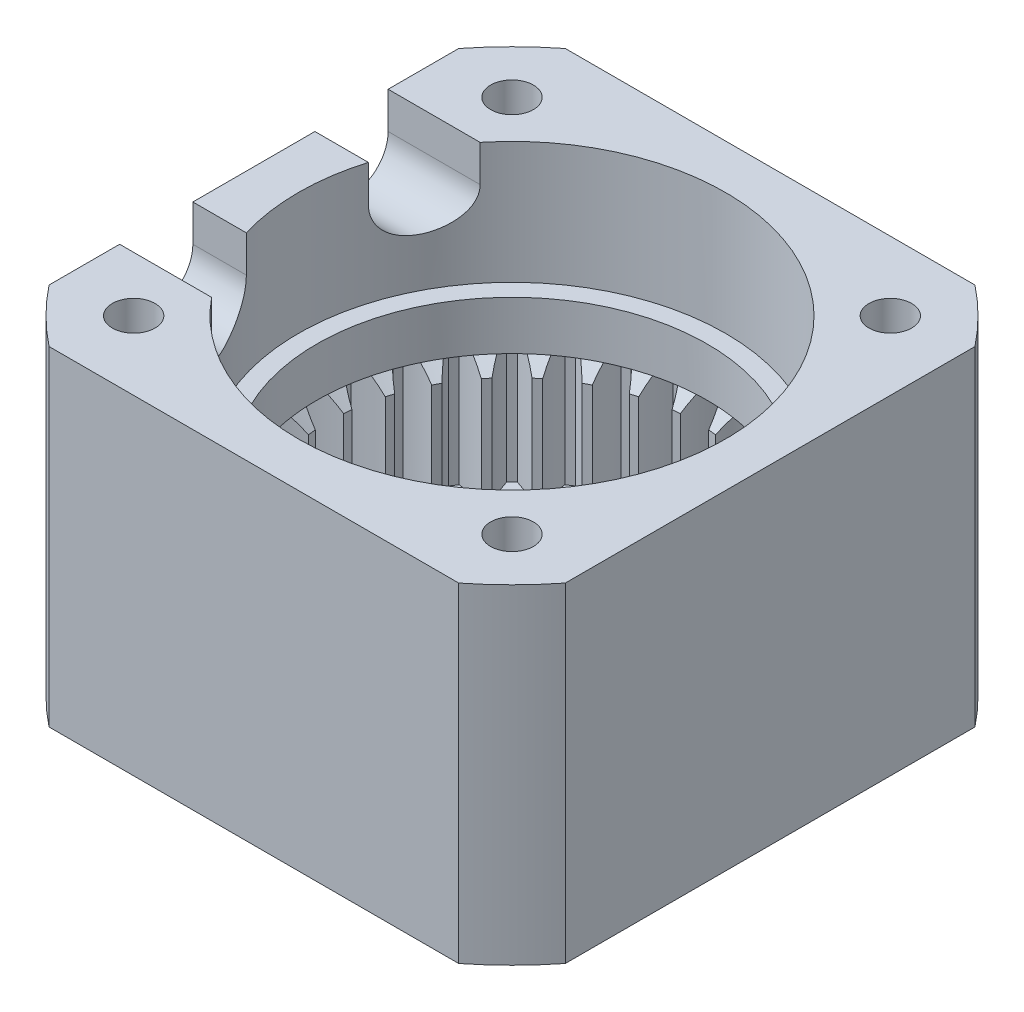
from build123d import *

# Parameters (mm, degrees)
SKETCH2_W           = 42.3
SKETCH2_H           = 42.3
BOSS_EXTRUDE1_DEPTH = 27
SKETCH3_R           = 11
CUT_EXTRUDE1_DEPTH  = 41.29447853
SKETCH4_R           = 1.75
CUT_EXTRUDE2_DEPTH  = 41.29447853
SKETCH5_R           = 29.910616844
SKETCH5_R_2         = 27
CUT_EXTRUDE4_DEPTH  = 41.29447853
SKETCH6_R           = 17.5
CUT_EXTRUDE5_DEPTH  = 24
BOSS_EXTRUDE2_START = 14
SKETCH7_R           = 17.5
SKETCH7_R_2         = 16
BOSS_EXTRUDE2_DEPTH = 14
SKETCH9_R           = 13
CUT_EXTRUDE6_DEPTH  = 39.348989556
INTERNAL_START      = 10
SKETCH12_R          = 16
SKETCH12_R_2        = 15
INTERNAL_GEAR_DEPTH = 10
CHAMFER4_SIZE       = 0.5
CAVITY2_START       = 3
CAVITY2_DEPTH       = 10
CUT_EXTRUDE7_DEPTH  = 10


# Read off the part's stored shape, not the designer's step: Cavity2
with BuildPart() as part:
    # Sketch2 → Boss-Extrude1 (new body)
    with BuildSketch(Plane(origin=(0, 0, 0), x_dir=(1, 0, 0), z_dir=(0, 1, 0))):
        Rectangle(SKETCH2_W, SKETCH2_H)
    extrude(amount=BOSS_EXTRUDE1_DEPTH)

    # Sketch3 → Cut-Extrude1 (cut, through all)
    with BuildSketch(Plane(origin=(0, 27, 0), x_dir=(1, 0, 0), z_dir=(0, 1, 0))):
        with Locations(Location((0, 0, 0), (0, 0, 270))):
            Circle(SKETCH3_R)
    extrude(amount=-CUT_EXTRUDE1_DEPTH, mode=Mode.SUBTRACT)

    # Sketch4 → Cut-Extrude2 (cut, through all)
    with BuildSketch(Plane(origin=(0, 27, 0), x_dir=(1, 0, 0), z_dir=(0, 1, 0))):
        with Locations(Location((-15.5, 15.5, 0), (0, 0, 270))):
            Circle(SKETCH4_R)
        with Locations(Location((15.5, 15.5, 0), (0, 0, 270))):
            Circle(SKETCH4_R)
        with Locations(Location((15.5, -15.5, 0), (0, 0, 270))):
            Circle(SKETCH4_R)
        with Locations(Location((-15.5, -15.5, 0), (0, 0, 270))):
            Circle(SKETCH4_R)
    extrude(amount=-CUT_EXTRUDE2_DEPTH, mode=Mode.SUBTRACT)

    # Sketch5 → Cut-Extrude4 (cut, through all)
    with BuildSketch(Plane(origin=(0, 27, 0), x_dir=(1, 0, 0), z_dir=(0, 1, 0))):
        Circle(SKETCH5_R)
        Circle(SKETCH5_R_2, mode=Mode.SUBTRACT)
    extrude(amount=-CUT_EXTRUDE4_DEPTH, mode=Mode.SUBTRACT)

    # Sketch6 → Cut-Extrude5 (cut)
    with BuildSketch(Plane(origin=(0, 27, 0), x_dir=(1, 0, 0), z_dir=(0, 1, 0))):
        with Locations(Location((0, 0, 0), (0, 0, 270))):
            Circle(SKETCH6_R)
    extrude(amount=-CUT_EXTRUDE5_DEPTH, mode=Mode.SUBTRACT)

    # Sketch7 → Boss-Extrude2 (add)
    with BuildSketch(Plane(origin=(0, 3, 0), x_dir=(1, 0, 0), z_dir=(0, 1, 0)).offset(BOSS_EXTRUDE2_START)):
        with Locations(Location((0, 0, 0), (0, 0, 270))):
            Circle(SKETCH7_R)
        with Locations(Location((0, 0, 0), (0, 0, 270))):
            Circle(SKETCH7_R_2, mode=Mode.SUBTRACT)
    extrude(amount=-BOSS_EXTRUDE2_DEPTH)

    # Sketch9 → Cut-Extrude6 (cut, through all)
    with BuildSketch(Plane(origin=(0, 3, 0), x_dir=(1, 0, 0), z_dir=(0, 1, 0))):
        with Locations(Location((0, 0, 0), (0, 0, 270))):
            Circle(SKETCH9_R)
    extrude(amount=-CUT_EXTRUDE6_DEPTH, mode=Mode.SUBTRACT)

    # Sketch12 → Internal gear (add)
    with BuildSketch(Plane(origin=(0, 3, 0), x_dir=(1, 0, 0), z_dir=(0, 1, 0)).offset(INTERNAL_START)):
        with Locations(Location((0, 0, 0), (0, 0, 270))):
            Circle(SKETCH12_R)
        with Locations(Location((0, 0, 0), (0, 0, 270))):
            Circle(SKETCH12_R_2, mode=Mode.SUBTRACT)
    extrude(amount=-INTERNAL_GEAR_DEPTH)

    # Chamfer4
    chamfer4_edges = [part.edges().sort_by_distance(p)[0] for p in [
        (-15.5, 0, 13.75),
        (15.5, 0, 13.75),
        (15.5, 0, -17.25),
        (-15.5, 0, -17.25),
    ]]
    chamfer(chamfer4_edges, length=CHAMFER4_SIZE)

    # Cavity2 outline → Cavity2 (cut)
    with BuildSketch(Plane(origin=(0, 0, 0), x_dir=(1, 0, 0), z_dir=(0, 1, 0)).offset(CAVITY2_START)):
        with BuildLine():
            ThreePointArc((-3.668509067, -16.856424361), (-3.365503145, -16.919526872), (-3.06141389, -16.977183099))
            ThreePointArc((-3.06141389, -16.977183099), (-2.340339096, -15.984916584), (-1.779431222, -14.894080184))
            ThreePointArc((-1.779431222, -14.894080184), (-2.92635483, -14.711779206), (-4.055737641, -14.441294685))
            ThreePointArc((-4.055737641, -14.441294685), (-3.954971354, -15.663746259), (-3.668509067, -16.856424361))
        make_face()
        with BuildLine():
            ThreePointArc((1.160450949, -14.95504442), (0, -15), (-1.160450949, -14.95504442))
            ThreePointArc((-1.160450949, -14.95504442), (-0.823132387, -16.134348402), (-0.309494437, -17.248223508))
            ThreePointArc((-0.309494437, -17.248223508), (0, -17.251), (0.309494437, -17.248223508))
            ThreePointArc((0.309494437, -17.248223508), (0.823132387, -16.134348402), (1.160450949, -14.95504442))
        make_face()
        with BuildLine():
            ThreePointArc((-6.314673798, -16.053719065), (-5.413872661, -15.221193386), (-4.650930849, -14.260744799))
            ThreePointArc((-4.650930849, -14.260744799), (-5.740251485, -13.858192988), (-6.79516461, -13.372574095))
            ThreePointArc((-6.79516461, -13.372574095), (-6.93482299, -14.591195132), (-6.88654495, -15.816842278))
            ThreePointArc((-6.88654495, -15.816842278), (-6.601671891, -15.937845815), (-6.314673798, -16.053719065))
        make_face()
        with BuildLine():
            ThreePointArc((4.055737641, -14.441294685), (2.92635483, -14.711779206), (1.779431222, -14.894080184))
            ThreePointArc((1.779431222, -14.894080184), (2.340339096, -15.984916584), (3.06141389, -16.977183099))
            ThreePointArc((3.06141389, -16.977183099), (3.365503145, -16.919526872), (3.668509067, -16.856424361))
            ThreePointArc((3.668509067, -16.856424361), (3.954971354, -15.663746259), (4.055737641, -14.441294685))
        make_face()
        with BuildLine():
            ThreePointArc((-9.325264334, -14.51331961), (-8.279354135, -13.872528263), (-7.343697812, -13.07937699))
            ThreePointArc((-7.343697812, -13.07937699), (-8.333553495, -12.472044185), (-9.273457214, -11.789952981))
            ThreePointArc((-9.273457214, -11.789952981), (-9.648173268, -12.957912559), (-9.839934773, -14.169427817))
            ThreePointArc((-9.839934773, -14.169427817), (-9.58414209, -14.343682282), (-9.325264334, -14.51331961))
        make_face()
        with BuildLine():
            ThreePointArc((6.79516461, -13.372574095), (5.740251485, -13.858192988), (4.650930849, -14.260744799))
            ThreePointArc((4.650930849, -14.260744799), (5.413872661, -15.221193386), (6.314673798, -16.053719065))
            ThreePointArc((6.314673798, -16.053719065), (6.601671891, -15.937845815), (6.88654495, -15.816842278))
            ThreePointArc((6.88654495, -15.816842278), (6.93482299, -14.591195132), (6.79516461, -13.372574095))
        make_face()
        with BuildLine():
            ThreePointArc((-11.977490191, -12.415181421), (-10.826664673, -11.990749658), (-9.754250587, -11.395376057))
            ThreePointArc((-9.754250587, -11.395376057), (-10.606601718, -10.606601718), (-11.395376057, -9.754250587))
            ThreePointArc((-11.395376057, -9.754250587), (-11.990749658, -10.826664673), (-12.415181421, -11.977490191))
            ThreePointArc((-12.415181421, -11.977490191), (-12.198299082, -12.198299082), (-11.977490191, -12.415181421))
        make_face()
        with BuildLine():
            ThreePointArc((9.273457214, -11.789952981), (8.333553495, -12.472044185), (7.343697812, -13.07937699))
            ThreePointArc((7.343697812, -13.07937699), (8.279354135, -13.872528263), (9.325264334, -14.51331961))
            ThreePointArc((9.325264334, -14.51331961), (9.58414209, -14.343682282), (9.839934773, -14.169427817))
            ThreePointArc((9.839934773, -14.169427817), (9.648173268, -12.957912559), (9.273457214, -11.789952981))
        make_face()
        with BuildLine():
            ThreePointArc((-14.169427817, -9.839934773), (-12.957912559, -9.648173268), (-11.789952981, -9.273457214))
            ThreePointArc((-11.789952981, -9.273457214), (-12.472044185, -8.333553495), (-13.07937699, -7.343697812))
            ThreePointArc((-13.07937699, -7.343697812), (-13.872528263, -8.279354135), (-14.51331961, -9.325264334))
            ThreePointArc((-14.51331961, -9.325264334), (-14.343682282, -9.58414209), (-14.169427817, -9.839934773))
        make_face()
        with BuildLine():
            ThreePointArc((11.395376057, -9.754250587), (10.606601718, -10.606601718), (9.754250587, -11.395376057))
            ThreePointArc((9.754250587, -11.395376057), (10.826664673, -11.990749658), (11.977490191, -12.415181421))
            ThreePointArc((11.977490191, -12.415181421), (12.198299082, -12.198299082), (12.415181421, -11.977490191))
            ThreePointArc((12.415181421, -11.977490191), (11.990749658, -10.826664673), (11.395376057, -9.754250587))
        make_face()
        with BuildLine():
            ThreePointArc((-15.816842278, -6.88654495), (-14.591195132, -6.93482299), (-13.372574095, -6.79516461))
            ThreePointArc((-13.372574095, -6.79516461), (-13.858192988, -5.740251485), (-14.260744799, -4.650930849))
            ThreePointArc((-14.260744799, -4.650930849), (-15.221193386, -5.413872661), (-16.053719065, -6.314673798))
            ThreePointArc((-16.053719065, -6.314673798), (-15.937845815, -6.601671891), (-15.816842278, -6.88654495))
        make_face()
        with BuildLine():
            ThreePointArc((13.07937699, -7.343697812), (12.472044185, -8.333553495), (11.789952981, -9.273457214))
            ThreePointArc((11.789952981, -9.273457214), (12.957912559, -9.648173268), (14.169427817, -9.839934773))
            ThreePointArc((14.169427817, -9.839934773), (14.343682282, -9.58414209), (14.51331961, -9.325264334))
            ThreePointArc((14.51331961, -9.325264334), (13.872528263, -8.279354135), (13.07937699, -7.343697812))
        make_face()
        with BuildLine():
            ThreePointArc((-16.856424361, -3.668509067), (-15.663746259, -3.954971354), (-14.441294685, -4.055737641))
            ThreePointArc((-14.441294685, -4.055737641), (-14.711779206, -2.92635483), (-14.894080184, -1.779431222))
            ThreePointArc((-14.894080184, -1.779431222), (-15.984916584, -2.340339096), (-16.977183099, -3.06141389))
            ThreePointArc((-16.977183099, -3.06141389), (-16.919526872, -3.365503145), (-16.856424361, -3.668509067))
        make_face()
        with BuildLine():
            ThreePointArc((14.260744799, -4.650930849), (13.858192988, -5.740251485), (13.372574095, -6.79516461))
            ThreePointArc((13.372574095, -6.79516461), (14.591195132, -6.93482299), (15.816842278, -6.88654495))
            ThreePointArc((15.816842278, -6.88654495), (15.937845815, -6.601671891), (16.053719065, -6.314673798))
            ThreePointArc((16.053719065, -6.314673798), (15.221193386, -5.413872661), (14.260744799, -4.650930849))
        make_face()
        with BuildLine():
            ThreePointArc((-17.248223508, -0.309494437), (-16.134348402, -0.823132387), (-14.95504442, -1.160450949))
            ThreePointArc((-14.95504442, -1.160450949), (-15, 0), (-14.95504442, 1.160450949))
            ThreePointArc((-14.95504442, 1.160450949), (-16.134348402, 0.823132387), (-17.248223508, 0.309494437))
            ThreePointArc((-17.248223508, 0.309494437), (-17.251, 0), (-17.248223508, -0.309494437))
        make_face()
        with BuildLine():
            ThreePointArc((14.894080184, -1.779431222), (14.711779206, -2.92635483), (14.441294685, -4.055737641))
            ThreePointArc((14.441294685, -4.055737641), (15.663746259, -3.954971354), (16.856424361, -3.668509067))
            ThreePointArc((16.856424361, -3.668509067), (16.919526872, -3.365503145), (16.977183099, -3.06141389))
            ThreePointArc((16.977183099, -3.06141389), (15.984916584, -2.340339096), (14.894080184, -1.779431222))
        make_face()
        with BuildLine():
            ThreePointArc((-16.977183099, 3.06141389), (-15.984916584, 2.340339096), (-14.894080184, 1.779431222))
            ThreePointArc((-14.894080184, 1.779431222), (-14.711779206, 2.92635483), (-14.441294685, 4.055737641))
            ThreePointArc((-14.441294685, 4.055737641), (-15.663746259, 3.954971354), (-16.856424361, 3.668509067))
            ThreePointArc((-16.856424361, 3.668509067), (-16.919526872, 3.365503145), (-16.977183099, 3.06141389))
        make_face()
        with BuildLine():
            ThreePointArc((14.95504442, 1.160450949), (15, 0), (14.95504442, -1.160450949))
            ThreePointArc((14.95504442, -1.160450949), (16.134348402, -0.823132387), (17.248223508, -0.309494437))
            ThreePointArc((17.248223508, -0.309494437), (17.251, 0), (17.248223508, 0.309494437))
            ThreePointArc((17.248223508, 0.309494437), (16.134348402, 0.823132387), (14.95504442, 1.160450949))
        make_face()
        with BuildLine():
            ThreePointArc((-16.053719065, 6.314673798), (-15.221193386, 5.413872661), (-14.260744799, 4.650930849))
            ThreePointArc((-14.260744799, 4.650930849), (-13.858192988, 5.740251485), (-13.372574095, 6.79516461))
            ThreePointArc((-13.372574095, 6.79516461), (-14.591195132, 6.93482299), (-15.816842278, 6.88654495))
            ThreePointArc((-15.816842278, 6.88654495), (-15.937845815, 6.601671891), (-16.053719065, 6.314673798))
        make_face()
        with BuildLine():
            ThreePointArc((-14.51331961, 9.325264334), (-13.872528263, 8.279354135), (-13.07937699, 7.343697812))
            ThreePointArc((-13.07937699, 7.343697812), (-12.472044185, 8.333553495), (-11.789952981, 9.273457214))
            ThreePointArc((-11.789952981, 9.273457214), (-12.957912559, 9.648173268), (-14.169427817, 9.839934773))
            ThreePointArc((-14.169427817, 9.839934773), (-14.343682282, 9.58414209), (-14.51331961, 9.325264334))
        make_face()
        with BuildLine():
            ThreePointArc((14.441294685, 4.055737641), (14.711779206, 2.92635483), (14.894080184, 1.779431222))
            ThreePointArc((14.894080184, 1.779431222), (15.984916584, 2.340339096), (16.977183099, 3.06141389))
            ThreePointArc((16.977183099, 3.06141389), (16.919526872, 3.365503145), (16.856424361, 3.668509067))
            ThreePointArc((16.856424361, 3.668509067), (15.663746259, 3.954971354), (14.441294685, 4.055737641))
        make_face()
        with BuildLine():
            ThreePointArc((-12.415181421, 11.977490191), (-11.990749658, 10.826664673), (-11.395376057, 9.754250587))
            ThreePointArc((-11.395376057, 9.754250587), (-10.606601718, 10.606601718), (-9.754250587, 11.395376057))
            ThreePointArc((-9.754250587, 11.395376057), (-10.826664673, 11.990749658), (-11.977490191, 12.415181421))
            ThreePointArc((-11.977490191, 12.415181421), (-12.198299082, 12.198299082), (-12.415181421, 11.977490191))
        make_face()
        with BuildLine():
            ThreePointArc((13.372574095, 6.79516461), (13.858192988, 5.740251485), (14.260744799, 4.650930849))
            ThreePointArc((14.260744799, 4.650930849), (15.221193386, 5.413872661), (16.053719065, 6.314673798))
            ThreePointArc((16.053719065, 6.314673798), (15.937845815, 6.601671891), (15.816842278, 6.88654495))
            ThreePointArc((15.816842278, 6.88654495), (14.591195132, 6.93482299), (13.372574095, 6.79516461))
        make_face()
        with BuildLine():
            ThreePointArc((-9.839934773, 14.169427817), (-9.648173268, 12.957912559), (-9.273457214, 11.789952981))
            ThreePointArc((-9.273457214, 11.789952981), (-8.333553495, 12.472044185), (-7.343697812, 13.07937699))
            ThreePointArc((-7.343697812, 13.07937699), (-8.279354135, 13.872528263), (-9.325264334, 14.51331961))
            ThreePointArc((-9.325264334, 14.51331961), (-9.58414209, 14.343682282), (-9.839934773, 14.169427817))
        make_face()
        with BuildLine():
            ThreePointArc((11.789952981, 9.273457214), (12.472044185, 8.333553495), (13.07937699, 7.343697812))
            ThreePointArc((13.07937699, 7.343697812), (13.872528263, 8.279354135), (14.51331961, 9.325264334))
            ThreePointArc((14.51331961, 9.325264334), (14.343682282, 9.58414209), (14.169427817, 9.839934773))
            ThreePointArc((14.169427817, 9.839934773), (12.957912559, 9.648173268), (11.789952981, 9.273457214))
        make_face()
        with BuildLine():
            ThreePointArc((-6.88654495, 15.816842278), (-6.93482299, 14.591195132), (-6.79516461, 13.372574095))
            ThreePointArc((-6.79516461, 13.372574095), (-5.740251485, 13.858192988), (-4.650930849, 14.260744799))
            ThreePointArc((-4.650930849, 14.260744799), (-5.413872661, 15.221193386), (-6.314673798, 16.053719065))
            ThreePointArc((-6.314673798, 16.053719065), (-6.601671891, 15.937845815), (-6.88654495, 15.816842278))
        make_face()
        with BuildLine():
            ThreePointArc((9.754250587, 11.395376057), (10.606601718, 10.606601718), (11.395376057, 9.754250587))
            ThreePointArc((11.395376057, 9.754250587), (11.990749658, 10.826664673), (12.415181421, 11.977490191))
            ThreePointArc((12.415181421, 11.977490191), (12.198299082, 12.198299082), (11.977490191, 12.415181421))
            ThreePointArc((11.977490191, 12.415181421), (10.826664673, 11.990749658), (9.754250587, 11.395376057))
        make_face()
        with BuildLine():
            ThreePointArc((-3.668509067, 16.856424361), (-3.954971354, 15.663746259), (-4.055737641, 14.441294685))
            ThreePointArc((-4.055737641, 14.441294685), (-2.92635483, 14.711779206), (-1.779431222, 14.894080184))
            ThreePointArc((-1.779431222, 14.894080184), (-2.340339096, 15.984916584), (-3.06141389, 16.977183099))
            ThreePointArc((-3.06141389, 16.977183099), (-3.365503145, 16.919526872), (-3.668509067, 16.856424361))
        make_face()
        with BuildLine():
            ThreePointArc((7.343697812, 13.07937699), (8.333553495, 12.472044185), (9.273457214, 11.789952981))
            ThreePointArc((9.273457214, 11.789952981), (9.648173268, 12.957912559), (9.839934773, 14.169427817))
            ThreePointArc((9.839934773, 14.169427817), (9.58414209, 14.343682282), (9.325264334, 14.51331961))
            ThreePointArc((9.325264334, 14.51331961), (8.279354135, 13.872528263), (7.343697812, 13.07937699))
        make_face()
        with BuildLine():
            ThreePointArc((-0.309494437, 17.248223508), (-0.823132387, 16.134348402), (-1.160450949, 14.95504442))
            ThreePointArc((-1.160450949, 14.95504442), (0, 15), (1.160450949, 14.95504442))
            ThreePointArc((1.160450949, 14.95504442), (0.823132387, 16.134348402), (0.309494437, 17.248223508))
            ThreePointArc((0.309494437, 17.248223508), (0, 17.251), (-0.309494437, 17.248223508))
        make_face()
        with BuildLine():
            ThreePointArc((4.650930849, 14.260744799), (5.740251485, 13.858192988), (6.79516461, 13.372574095))
            ThreePointArc((6.79516461, 13.372574095), (6.93482299, 14.591195132), (6.88654495, 15.816842278))
            ThreePointArc((6.88654495, 15.816842278), (6.601671891, 15.937845815), (6.314673798, 16.053719065))
            ThreePointArc((6.314673798, 16.053719065), (5.413872661, 15.221193386), (4.650930849, 14.260744799))
        make_face()
        with BuildLine():
            ThreePointArc((3.06141389, 16.977183099), (2.340339096, 15.984916584), (1.779431222, 14.894080184))
            ThreePointArc((1.779431222, 14.894080184), (2.92635483, 14.711779206), (4.055737641, 14.441294685))
            ThreePointArc((4.055737641, 14.441294685), (3.954971354, 15.663746259), (3.668509067, 16.856424361))
            ThreePointArc((3.668509067, 16.856424361), (3.365503145, 16.919526872), (3.06141389, 16.977183099))
        make_face()
    extrude(amount=CAVITY2_DEPTH, mode=Mode.SUBTRACT)

    # Sketch13 → Cut-Revolve4 (revolve, cut)
    with BuildSketch(Plane(origin=(0, 0, 0), x_dir=(0, 0, -1), z_dir=(1, 0, 0)), mode=Mode.PRIVATE) as cut_revolve4_sk:
        Polygon((-16, 13), (-15, 12), (-15, 13), align=None)
    revolve(cut_revolve4_sk.sketch.rotate(Axis((0, 27, 0), (0, -1, 0)), 183.153155717), axis=Axis((0, 27, 0), (0, -1, 0)), mode=Mode.SUBTRACT)

    # Sketch14 → Cut-Extrude7 (cut)
    with BuildSketch(Plane.ZY.offset(21.15)):
        with BuildLine():
            Line((-11, 24), (-11, 27))
            Line((-11, 27), (-5, 27))
            Line((-5, 27), (-5, 24))
            ThreePointArc((-5, 24), (-8, 21), (-11, 24))
        make_face()
        with BuildLine():
            Line((5, 24), (5, 27))
            Line((5, 27), (11, 27))
            Line((11, 27), (11, 24))
            ThreePointArc((11, 24), (8, 21), (5, 24))
        make_face()
    extrude(amount=-CUT_EXTRUDE7_DEPTH, mode=Mode.SUBTRACT)


solid = part.part
